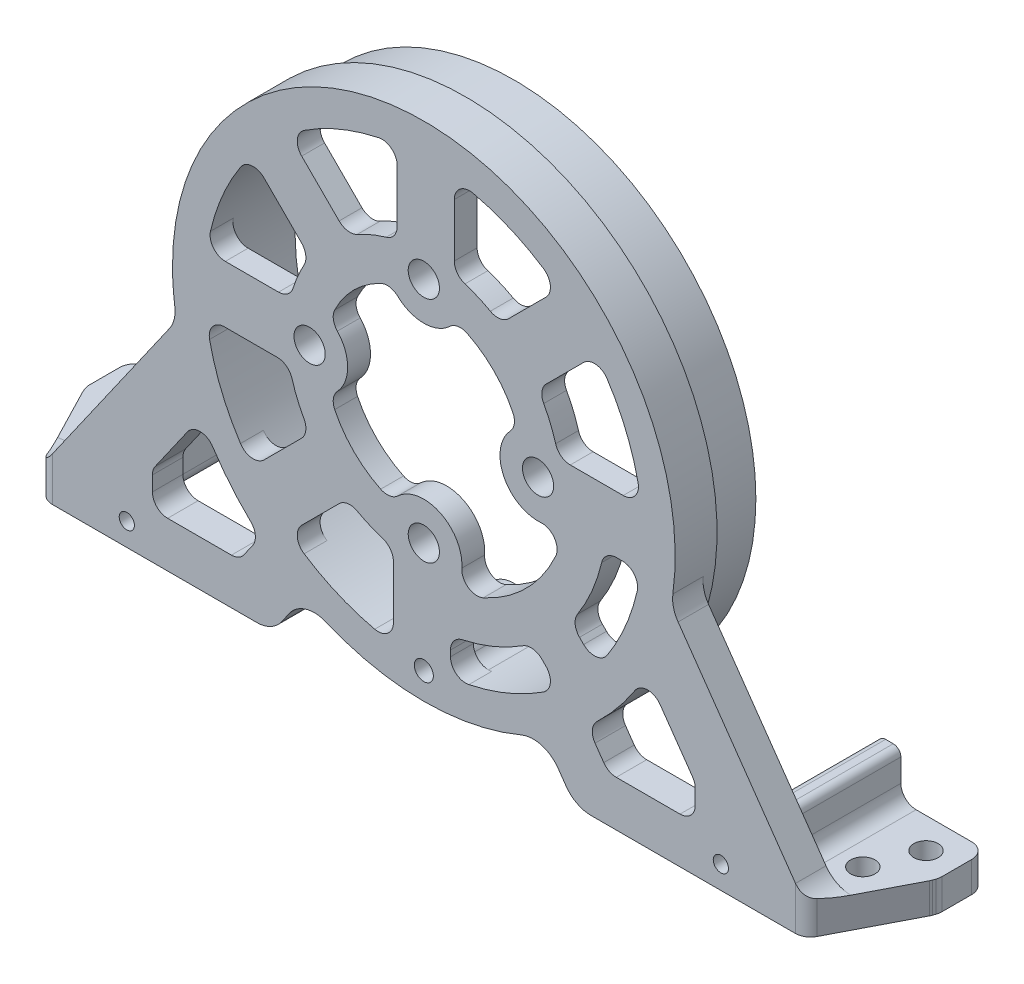
from build123d import *

# Parameters (mm, degrees)
SKETCH_1_R             = 31.75
SKETCH_1_R_2           = 28.75
EXTRUDE_1_DEPTH        = 6.35
EXTRUDE_START          = -3
SKETCH_3_R             = 2.05
EXTRUDE_2_DEPTH        = 3
FILLET_1_R             = 2
EXTRUDE_3_DEPTH        = 4
SKETCH_5_R             = 1.6
EXTRUDE_4_DEPTH        = 4
SKETCH_7_W             = 3
SKETCH_7_H             = 6
EXTRUDE_5_DEPTH        = 14
FILLET_2_R             = 4
FILLET_3_R             = 2
FILLET_4_R             = 1
SKETCH_9_R             = 1
CUT_EXTRUDE_1_DEPTH    = 68.457677193
CUT_EXTRUDE_START      = -10
CUT_EXTRUDE_3_DEPTH    = 10
FILLET_6_R             = 2
SKETCH_10_R            = 1
CUT_EXTRUDE_2_DEPTH    = 2
EXTRUDE_START_2        = 8.85
EXTRUDE_6_DEPTH        = 8.85
FILLET_5_R             = 2
HOLE_WIZARD_M3_1_D     = 2.5
HOLE_WIZARD_M3_1_DEPTH = 7.5
HOLE_WIZARD_M3_1_TIP   = 0.751075774


with BuildPart() as part:
    # 草图1 → 凸台-拉伸1 (new body)
    with BuildSketch(Plane.XY):
        Circle(SKETCH_1_R)
        Circle(SKETCH_1_R_2, mode=Mode.SUBTRACT)
    extrude(amount=EXTRUDE_1_DEPTH)

    # 草图2 → 旋转1 (revolve)
    with BuildSketch(Plane(origin=(0, 0, 0), x_dir=(0, 0, -1), z_dir=(1, 0, 0)), mode=Mode.PRIVATE) as revolve_1_sk:
        Polygon((-6.35, 31.75), (-6.35, 33), (-11.85, 33), (-11.85, 28.75), (-6.35, 28.75), align=None)
    revolve(revolve_1_sk.sketch.rotate(Axis((0, 0, 0), (0, 0, 1)), 90), axis=Axis((0, 0, 0), (0, 0, 1)))

    # 草图3 → 凸台-拉伸2 (add)
    with BuildSketch(Plane.XY.offset(11.85).offset(EXTRUDE_START)):
        with BuildLine():
            Line((-3.5, 28.53616127), (-3.5, 17.656443583))
            ThreePointArc((-3.5, 17.656443583), (-6.888301783, 16.629831585), (-10.010117255, 14.959864723))
            Line((-10.010117255, 14.959864723), (-17.703239409, 22.652986877))
            ThreePointArc((-17.703239409, 22.652986877), (-20.329319959, 20.329319959), (-22.652986877, 17.703239409))
            Line((-22.652986877, 17.703239409), (-14.959864723, 10.010117255))
            ThreePointArc((-14.959864723, 10.010117255), (-16.530337131, 7.123759845), (-17.549928775, 4))
            Line((-17.549928775, 4), (-28.470379344, 4))
            ThreePointArc((-28.470379344, 4), (-28.748894208, 0.252154348), (-28.53616127, -3.5))
            Line((-28.53616127, -3.5), (-17.656443583, -3.5))
            ThreePointArc((-17.656443583, -3.5), (-16.629831585, -6.888301783), (-14.959864723, -10.010117255))
            Line((-14.959864723, -10.010117255), (-22.652986877, -17.703239409))
            ThreePointArc((-22.652986877, -17.703239409), (-20.329319959, -20.329319959), (-17.703239409, -22.652986877))
            Line((-17.703239409, -22.652986877), (-10.010117255, -14.959864723))
            ThreePointArc((-10.010117255, -14.959864723), (-7.123759845, -16.530337131), (-4, -17.549928775))
            Line((-4, -17.549928775), (-4, -28.470379344))
            ThreePointArc((-4, -28.470379344), (-0.252154348, -28.748894208), (3.5, -28.53616127))
            Line((3.5, -28.53616127), (3.5, -23.743420141))
            ThreePointArc((3.5, -23.743420141), (9.184402377, -22.17310878), (14.314259656, -19.264007125))
            Line((14.314259656, -19.264007125), (17.703239409, -22.652986877))
            ThreePointArc((17.703239409, -22.652986877), (20.329319959, -20.329319959), (22.652986877, -17.703239409))
            Line((22.652986877, -17.703239409), (19.264007125, -14.314259656))
            ThreePointArc((19.264007125, -14.314259656), (22.075014991, -9.41773397), (23.664319132, -4))
            Line((23.664319132, -4), (28.470379344, -4))
            ThreePointArc((28.470379344, -4), (28.748894208, -0.252154348), (28.53616127, 3.5))
            Line((28.53616127, 3.5), (17.656443583, 3.5))
            ThreePointArc((17.656443583, 3.5), (16.629831585, 6.888301783), (14.959864723, 10.010117255))
            Line((14.959864723, 10.010117255), (22.652986877, 17.703239409))
            ThreePointArc((22.652986877, 17.703239409), (20.329319959, 20.329319959), (17.703239409, 22.652986877))
            Line((17.703239409, 22.652986877), (10.010117255, 14.959864723))
            ThreePointArc((10.010117255, 14.959864723), (7.123759845, 16.530337131), (4, 17.549928775))
            Line((4, 17.549928775), (4, 28.470379344))
            ThreePointArc((4, 28.470379344), (0.252154348, 28.748894208), (-3.5, 28.53616127))
        make_face()
        with Locations((15, 0)):
            Circle(SKETCH_3_R, mode=Mode.SUBTRACT)
        with Locations((0, -15)):
            Circle(SKETCH_3_R, mode=Mode.SUBTRACT)
        with Locations((-15, 0)):
            Circle(SKETCH_3_R, mode=Mode.SUBTRACT)
        with Locations((0, 15)):
            Circle(SKETCH_3_R, mode=Mode.SUBTRACT)
        with BuildLine():
            ThreePointArc((12.3, 4.208325083), (9.192388155, 9.192388155), (4.208325083, 12.3))
            ThreePointArc((4.208325083, 12.3), (0, 10), (-4.208325083, 12.3))
            ThreePointArc((-4.208325083, 12.3), (-9.192388155, 9.192388155), (-12.3, 4.208325083))
            ThreePointArc((-12.3, 4.208325083), (-10, 0), (-12.3, -4.208325083))
            ThreePointArc((-12.3, -4.208325083), (-9.192388155, -9.192388155), (-4.208325083, -12.3))
            ThreePointArc((-4.208325083, -12.3), (3.227790128, -11.181443873), (3.363034344, -18.7))
            ThreePointArc((3.363034344, -18.7), (13.435028843, -13.435028843), (18.7, -3.363034344))
            ThreePointArc((18.7, -3.363034344), (11.181443873, -3.227790128), (12.3, 4.208325083))
        make_face(mode=Mode.SUBTRACT)
    extrude(amount=EXTRUDE_2_DEPTH)

    # 圆角1
    fillet_1_edges = [part.edges().sort_by_distance(p)[0] for p in [
        (14.314259656, -19.264007125, 10.35),
        (3.5, -23.743420141, 10.35),
        (3.5, -28.53616127, 10.35),
        (-4, -28.470379344, 10.35),
        (-4, -17.549928775, 10.35),
        (-10.010117255, -14.959864723, 10.35),
        (-17.703239409, -22.652986877, 10.35),
        (-22.652986877, -17.703239409, 10.35),
        (-14.959864723, -10.010117255, 10.35),
        (-17.656443583, -3.5, 10.35),
        (-28.53616127, -3.5, 10.35),
        (-28.470379344, 4, 10.35),
        (-17.549928775, 4, 10.35),
        (-14.959864723, 10.010117255, 10.35),
        (-22.652986877, 17.703239409, 10.35),
        (-17.703239409, 22.652986877, 10.35),
        (-10.010117255, 14.959864723, 10.35),
        (-3.5, 17.656443583, 10.35),
        (-3.5, 28.53616127, 10.35),
        (4, 28.470379344, 10.35),
        (4, 17.549928775, 10.35),
        (10.010117255, 14.959864723, 10.35),
        (17.703239409, 22.652986877, 10.35),
        (22.652986877, 17.703239409, 10.35),
        (14.959864723, 10.010117255, 10.35),
        (17.656443583, 3.5, 10.35),
        (28.53616127, 3.5, 10.35),
        (28.470379344, -4, 10.35),
        (23.664319132, -4, 10.35),
        (19.264007125, -14.314259656, 10.35),
        (22.652986877, -17.703239409, 10.35),
        (17.703239409, -22.652986877, 10.35),
        (4.208325083, 12.3, 10.35),
        (12.3, 4.208325083, 10.35),
        (18.7, -3.363034344, 10.35),
        (3.363034344, -18.7, 10.35),
        (-4.208325083, -12.3, 10.35),
        (-12.3, -4.208325083, 10.35),
        (-12.3, 4.208325083, 10.35),
        (-4.208325083, 12.3, 10.35),
    ]]
    fillet(fillet_1_edges, radius=FILLET_1_R)

    # 草图4 → 凸台-拉伸3 (add)
    with BuildSketch(Plane.XY.offset(11.85)):
        with BuildLine():
            Line((50, -35), (19.879528589, -35))
            Line((19.879528589, -35), (15.697464802, -29.027393938))
            ThreePointArc((15.697464802, -29.027393938), (26.700529446, -19.392826698), (32.459298295, -5.949281823))
            Line((32.459298295, -5.949281823), (50, -31))
            Line((50, -31), (50, -35))
        make_face()
        with BuildLine():
            Line((-50, -35), (-50, -31))
            Line((-50, -31), (-32.459298295, -5.949281823))
            ThreePointArc((-32.459298295, -5.949281823), (-26.700529446, -19.392826698), (-15.697464802, -29.027393938))
            Line((-15.697464802, -29.027393938), (-19.879528589, -35))
            Line((-19.879528589, -35), (-50, -35))
        make_face()
    extrude(amount=-EXTRUDE_3_DEPTH)

    # 草图5 → 凸台-拉伸4 (add)
    # profile 1 of 2: a face of its own
    with BuildSketch(Plane.XZ.offset(35)):
        with BuildLine():
            Line((55.942275653, -6.15), (41.638694584, -6.15))
            Line((41.638694584, -6.15), (41.638694584, 7.85))
            Line((41.638694584, 7.85), (50, 7.85))
            Line((50, 7.85), (50, 11.85))
            Line((50, 11.85), (55.657658931, 0.926133488))
            ThreePointArc((55.657658931, 0.926133488), (55.801506118, 0.512252345), (55.942275653, 0.097314335))
            Line((55.942275653, 0.097314335), (55.942275653, -6.15))
        make_face()
        with Locations(Location((49.638694584, 3.85, 0), (0, 0, 270))):
            Circle(SKETCH_5_R, mode=Mode.SUBTRACT)
        with Locations(Location((51.942275653, -2.15, 0), (0, 0, 270))):
            Circle(SKETCH_5_R, mode=Mode.SUBTRACT)
    # profile 2 of 2: a face of its own
    with BuildSketch(Plane.XZ.offset(35)):
        with BuildLine():
            Line((-50, 11.85), (-50, 7.85))
            Line((-50, 7.85), (-41.638694584, 7.85))
            Line((-41.638694584, 7.85), (-41.638694584, -6.15))
            Line((-41.638694584, -6.15), (-55.942275653, -6.15))
            Line((-55.942275653, -6.15), (-55.942275653, 0.097314335))
            ThreePointArc((-55.942275653, 0.097314335), (-55.801506118, 0.512252345), (-55.657658931, 0.926133488))
            Line((-55.657658931, 0.926133488), (-50, 11.85))
        make_face()
        with Locations(Location((-49.638694584, 3.85, 0), (0, 0, 90))):
            Circle(SKETCH_5_R, mode=Mode.SUBTRACT)
        with Locations(Location((-51.942275653, -2.15, 0), (0, 0, 90))):
            Circle(SKETCH_5_R, mode=Mode.SUBTRACT)
    extrude(amount=-EXTRUDE_4_DEPTH)

    # 草图7 → 凸台-拉伸5 (add)
    with BuildSketch(Plane(origin=(0, 0, 7.85), x_dir=(-1, 0, 0), z_dir=(0, 0, -1))):
        with Locations((-43.138694584, -28)):
            Rectangle(SKETCH_7_W, SKETCH_7_H)
        with Locations((43.138694584, -28)):
            Rectangle(SKETCH_7_W, SKETCH_7_H)
    extrude(amount=EXTRUDE_5_DEPTH)

    # 圆角2
    # the kernel refuses this fillet: 4 mm, written as the material it adds along each edge
    with BuildSketch(Plane(origin=(50, -31, 11.85), x_dir=(-0.5735764363510467, 0.8191520442889915, 0), z_dir=(0, 0, -1))) as fillet_2_piece_1_section:
        with BuildLine():
            CenterArc((FILLET_2_R * 0.520567050552, FILLET_2_R), FILLET_2_R, 215, 55)
            Line((-FILLET_2_R * 0.298584993737, FILLET_2_R * 0.426423563649), (0, 0))
            Line((0, 0), (FILLET_2_R * 0.520567050552, 0))
        make_face()
    fillet_2_piece_1 = extrude(amount=4, mode=Mode.PRIVATE)
    fillet_2_piece_1 = split(fillet_2_piece_1, bisect_by=Plane(origin=(50.902013827, -30.559834141, 10.108382353), z_dir=(-0.887972612405044, 0, -0.4598963357307401)), keep=Keep.TOP, mode=Mode.PRIVATE)
    add(fillet_2_piece_1)
    with BuildSketch(Plane(origin=(15.697464802, -29.027393938, 11.85), x_dir=(-0.9016501167116603, -0.43246626115091263, 0), z_dir=(0, 0, -1))) as fillet_2_piece_2:
        with BuildLine():
            CenterArc((3.39447488, -3.995294187), FILLET_2_R, 92.779505561, 77.844671829)
            Line((-0.552089093, -3.343655632), (0, 0))
            ThreePointArc((0, 0), (1.600252443, -0.038822956), (3.200504886, 0))
        make_face()
    extrude(amount=4)
    with BuildSketch(Plane(origin=(32.459298295, -5.949281823, 11.85), x_dir=(0.15747410144083315, 0.9875231173878423, 0), z_dir=(0, 0, -1))) as fillet_2_piece_3:
        with BuildLine():
            CenterArc((1.61966106, 3.998929121), FILLET_2_R, 225.939685675, 42.734485392)
            Line((-1.161999831, 1.124496535), (0, 0))
            ThreePointArc((0, 0), (0.7635545, 0.00883475), (1.527108999, 0))
        make_face()
    extrude(amount=4)
    with BuildSketch(Plane(origin=(-50, -31, 11.85), x_dir=(-1, 0, 0), z_dir=(0, 0, -1))) as fillet_2_piece_4_section:
        with BuildLine():
            CenterArc((FILLET_2_R * 0.520567050552, FILLET_2_R), FILLET_2_R, 215, 55)
            Line((-FILLET_2_R * 0.298584993737, FILLET_2_R * 0.426423563649), (0, 0))
            Line((0, 0), (FILLET_2_R * 0.520567050552, 0))
        make_face()
    fillet_2_piece_4 = extrude(amount=4, mode=Mode.PRIVATE)
    fillet_2_piece_4 = split(fillet_2_piece_4, bisect_by=Plane(origin=(-50.902013827, -30.559834141, 10.108382353), z_dir=(0.887972612405044, 0, -0.45989633573074)), keep=Keep.TOP, mode=Mode.PRIVATE)
    add(fillet_2_piece_4)
    with BuildSketch(Plane(origin=(-32.459298295, -5.949281823, 11.85), x_dir=(-0.15747410144083307, 0.9875231173878423, 0), z_dir=(0, 0, -1))) as fillet_2_piece_5:
        with BuildLine():
            CenterArc((1.61966106, -3.998929121), FILLET_2_R, 91.325828933, 42.734485392)
            Line((-1.161999831, -1.124496535), (0, 0))
            ThreePointArc((0, 0), (0.7635545, -0.00883475), (1.527108999, 0))
        make_face()
    extrude(amount=4)
    with BuildSketch(Plane(origin=(-15.697464802, -29.027393938, 11.85), x_dir=(0.90165011671166, -0.4324662611509133, 0), z_dir=(0, 0, -1))) as fillet_2_piece_6:
        with BuildLine():
            CenterArc((3.39447488, 3.995294187), FILLET_2_R, 189.37582261, 77.844671829)
            Line((-0.552089093, 3.343655632), (0, 0))
            ThreePointArc((0, 0), (1.600252443, 0.038822956), (3.200504886, 0))
        make_face()
    extrude(amount=4)
    # the kernel refuses this fillet: 4 mm, written as the material it takes off along each edge
    with BuildSketch(Plane(origin=(19.879528589, -35, 17.055670506), x_dir=(-0.5735764363510478, 0.8191520442889906, 0), z_dir=(0, 0, -1)), Plane(origin=(-19.879528589, -35, 17.055670506), x_dir=(-1, 0, 0), z_dir=(0, 0, -1))) as fillet_2_2_piece_1:
        with BuildLine():
            CenterArc((FILLET_2_R * 0.520567050552, FILLET_2_R), FILLET_2_R, 215, 55)
            Line((-FILLET_2_R * 0.298584993737, FILLET_2_R * 0.426423563649), (0, 0))
            Line((0, 0), (FILLET_2_R * 0.520567050552, 0))
        make_face()
    extrude(amount=14.411341011, mode=Mode.SUBTRACT)

    # 圆角3
    fillet_3_edges = [part.edges().sort_by_distance(p)[0] for p in [
        (44.638694584, -31, 0.85),
        (-44.638694584, -31, 0.85),
        (41.638694584, -35, 0.85),
        (-50, -32.707641585, 11.85),
        (50, -32.707641585, 11.85),
        (55.942275653, -33, -6.15),
        (-55.942275653, -33, -6.15),
        (-41.638694584, -35, 0.85),
        (55.657658931, -33, 0.926133488),
        (55.942275653, -33, 0.097314335),
        (-55.942275653, -33, 0.097314335),
        (-55.657658931, -33, 0.926133488),
    ]]
    fillet(fillet_3_edges, radius=FILLET_3_R)

    # 圆角4
    fillet_4_edges = [part.edges().sort_by_distance(p)[0] for p in [
        (44.638694584, -25, 0.85),
        (41.638694584, -25, 0.85),
        (-44.638694584, -25, 0.85),
        (-41.638694584, -25, 0.85),
    ]]
    fillet(fillet_4_edges, radius=FILLET_4_R)

    # 草图9 → 切除-拉伸1 (cut, through all)
    with BuildSketch(Plane(origin=(0, 0, 7.85), x_dir=(-1, 0, 0), z_dir=(0, 0, -1))):
        with Locations((-39, -32)):
            Circle(SKETCH_9_R)
        with Locations(Location((39, -32, 0), (0, 0, 180))):
            Circle(SKETCH_9_R)
    extrude(amount=-CUT_EXTRUDE_1_DEPTH, mode=Mode.SUBTRACT)

    # 草图12 → 切除-拉伸3 (cut)
    with BuildSketch(Plane(origin=(0, 0, 7.85), x_dir=(-1, 0, 0), z_dir=(0, 0, -1)).offset(CUT_EXTRUDE_START)):
        with BuildLine():
            Line((24.223705481, -29), (35.638694584, -29))
            Line((35.638694584, -29), (35.638694584, -24.437504661))
            Line((35.638694584, -24.437504661), (29.239571472, -15.298609744))
            ThreePointArc((29.239571472, -15.298609744), (25.819153913, -20.551673684), (21.467114492, -25.063180073))
            Line((21.467114492, -25.063180073), (24.223705481, -29))
        make_face()
        with BuildLine():
            Line((-24.223705481, -29), (-35.638694584, -29))
            Line((-35.638694584, -29), (-35.638694584, -24.437504661))
            Line((-35.638694584, -24.437504661), (-29.239571472, -15.298609744))
            ThreePointArc((-29.239571472, -15.298609744), (-25.819153913, -20.551673684), (-21.467114492, -25.063180073))
            Line((-21.467114492, -25.063180073), (-24.223705481, -29))
        make_face()
    extrude(amount=CUT_EXTRUDE_3_DEPTH, mode=Mode.SUBTRACT)

    # 圆角6
    # the kernel refuses this fillet: 2 mm, written as the material it adds along each edge
    with BuildSketch(Plane(origin=(-24.223705481, -29, 11.85), x_dir=(-1, 0, 0), z_dir=(0, 0, -1)), Plane(origin=(24.223705481, -29, 11.85), x_dir=(-0.5735764363510483, 0.8191520442889904, 0), z_dir=(0, 0, -1))) as fillet_6_piece_1:
        with BuildLine():
            CenterArc((FILLET_6_R * 0.520567050552, FILLET_6_R), FILLET_6_R, 215, 55)
            Line((-FILLET_6_R * 0.298584993737, FILLET_6_R * 0.426423563649), (0, 0))
            Line((0, 0), (FILLET_6_R * 0.520567050552, 0))
        make_face()
    extrude(amount=4)
    with BuildSketch(Plane(origin=(-21.467114492, -25.063180073, 11.85), x_dir=(-0.7423264127571082, 0.6700384294375685, 0), z_dir=(0, 0, -1))) as fillet_6_piece_2:
        with BuildLine():
            CenterArc((1.767356514, -1.999324378), FILLET_6_R, 91.489315782, 81.440653345)
            Line((-0.217436392, -1.753159556), (0, 0))
            ThreePointArc((0, 0), (0.85768772, -0.011147765), (1.71537544, 0))
        make_face()
    extrude(amount=4)
    with BuildSketch(Plane(origin=(-29.239571472, -15.298609744, 11.85), x_dir=(0.5038009997201635, -0.8638197454799028, 0), z_dir=(0, 0, -1))) as fillet_6_piece_3:
        with BuildLine():
            CenterArc((3.123227974, 1.997889338), FILLET_6_R, 155.251792354, 112.115696504)
            Line((1.306915434, 2.835151994), (0, 0))
            ThreePointArc((0, 0), (1.515684164, 0.034825929), (3.031368327, 0))
        make_face()
    extrude(amount=4)
    with BuildSketch(Plane(origin=(-35.638694584, -24.437504661, 11.85), x_dir=(0.5735764363510468, 0.8191520442889912, 0), z_dir=(0, 0, -1)), Plane(origin=(35.638694584, -24.437504661, 11.85), x_dir=(0, -1, 0), z_dir=(0, 0, -1))) as fillet_6_piece_4:
        with BuildLine():
            CenterArc((FILLET_6_R * 0.315298788879, FILLET_6_R), FILLET_6_R, 235, 35)
            Line((-FILLET_6_R * 0.258277647472, FILLET_6_R * 0.180847955711), (0, 0))
            Line((0, 0), (FILLET_6_R * 0.315298788879, 0))
        make_face()
    extrude(amount=4)
    with BuildSketch(Plane(origin=(-35.638694584, -29, 11.85), x_dir=(0, 1, 0), z_dir=(0, 0, -1)), Plane(origin=(35.638694584, -29, 11.85), x_dir=(-1, 0, 0), z_dir=(0, 0, -1))) as fillet_6_piece_5:
        with BuildLine():
            CenterArc((FILLET_6_R, FILLET_6_R), FILLET_6_R, 180, 90)
            Line((0, FILLET_6_R), (0, 0))
            Line((0, 0), (FILLET_6_R, 0))
        make_face()
    extrude(amount=4)
    with BuildSketch(Plane(origin=(29.239571472, -15.298609744, 11.85), x_dir=(0.5735764363510477, -0.8191520442889907, 0), z_dir=(0, 0, -1))) as fillet_6_piece_6:
        with BuildLine():
            CenterArc((3.121876804, 2), FILLET_6_R, 157.884303496, 112.115696504)
            ThreePointArc((1.26902575, 2.752956154), (0.666140261, 1.361898852), (0, 0))
            Line((0, 0), (3.121876804, 0))
        make_face()
    extrude(amount=4)
    with BuildSketch(Plane(origin=(21.467114492, -25.063180073, 11.85), x_dir=(0.5735764363510463, -0.8191520442889917, 0), z_dir=(0, 0, -1))) as fillet_6_piece_7:
        with BuildLine():
            CenterArc((1.766591921, -2), FILLET_6_R, 90, 81.440653344)
            ThreePointArc((-0.211132545, -1.702332502), (-0.09450327, -0.852538345), (0, 0))
            Line((0, 0), (1.766591921, 0))
        make_face()
    extrude(amount=4)

    # 草图10 → 切除-拉伸2 (cut)
    with BuildSketch(Plane.XY.offset(11.85)):
        with Locations((0, -29.5)):
            Circle(SKETCH_10_R)
    extrude(amount=-CUT_EXTRUDE_2_DEPTH, mode=Mode.SUBTRACT)

    # 草图11 → 凸台-拉伸6 (add)
    with BuildSketch(Plane(origin=(0, 0, 8.85), x_dir=(-1, 0, 0), z_dir=(0, 0, -1)).offset(EXTRUDE_START_2)):
        with BuildLine():
            ThreePointArc((3.86995596, -28.488347458), (0, -25.5), (-3.86995596, -28.488347458))
            ThreePointArc((-3.86995596, -28.488347458), (0, -28.75), (3.86995596, -28.488347458))
        make_face()
    extrude(amount=-EXTRUDE_6_DEPTH)

    # 圆角5
    fillet_5_edges = [part.edges().sort_by_distance(p)[0] for p in [
        (-3.86995596, -28.488347458, 4.425),
        (3.86995596, -28.488347458, 4.425),
    ]]
    fillet(fillet_5_edges, radius=FILLET_5_R)

    # M3 螺纹孔1
    with Locations(Plane(origin=(0, -29.5, 11.85), x_dir=(1, 0, 0), z_dir=(0, 0, 1))):
        with Locations((0, 0)):
            Hole(HOLE_WIZARD_M3_1_D / 2, depth=HOLE_WIZARD_M3_1_DEPTH)
            with Locations((0, 0, -(HOLE_WIZARD_M3_1_DEPTH + HOLE_WIZARD_M3_1_TIP / 2))):  # 118° drill point
                Cone(0, HOLE_WIZARD_M3_1_D / 2, HOLE_WIZARD_M3_1_TIP, mode=Mode.SUBTRACT)


solid = part.part
